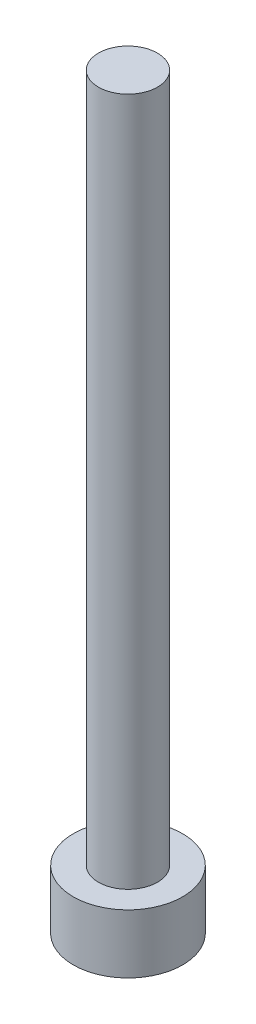
from build123d import *

# Parameters (mm, degrees)
SKETCH1_R           = 2.78
BOSS_EXTRUDE1_DEPTH = 3
SKETCH2_R           = 1.5
BOSS_EXTRUDE2_DEPTH = 35


with BuildPart() as part:
    # Sketch1 → Boss-Extrude1 (new body)
    with BuildSketch(Plane(origin=(0, 0, 0), x_dir=(1, 0, 0), z_dir=(0, 1, 0))):
        Circle(SKETCH1_R)
    extrude(amount=BOSS_EXTRUDE1_DEPTH)

    # Sketch2 → Boss-Extrude2 (add)
    with BuildSketch(Plane(origin=(0, 3, 0), x_dir=(1, 0, 0), z_dir=(0, 1, 0))):
        Circle(SKETCH2_R)
    extrude(amount=BOSS_EXTRUDE2_DEPTH)


solid = part.part
